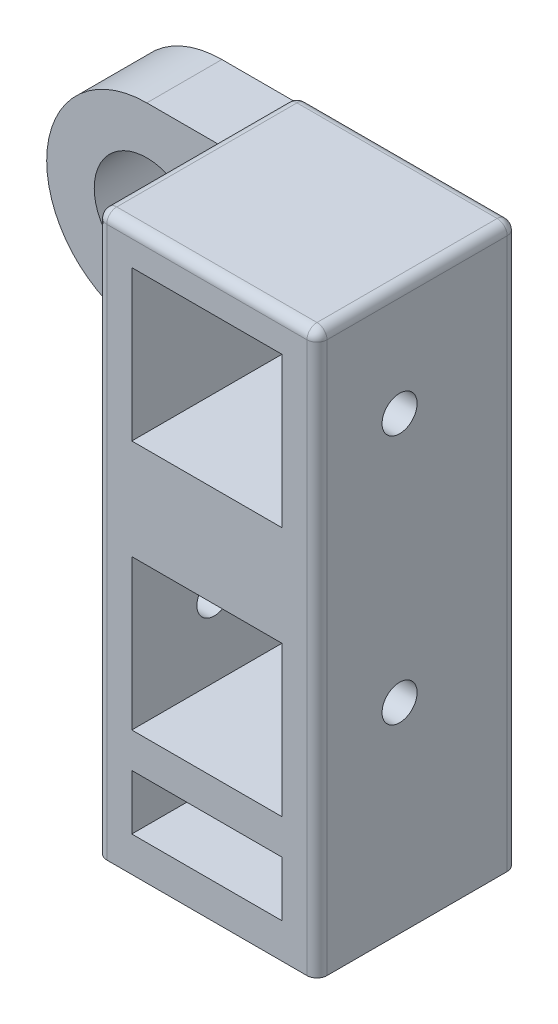
from build123d import *

# Parameters (mm, degrees)
SKETCH1_W           = 22
SKETCH1_H           = 56
SKETCH1_W_2         = 15
SKETCH1_H_2         = 15
BOSS_EXTRUDE1_DEPTH = 20
SKETCH2_W           = 15
SKETCH2_H           = 15
SKETCH2_H_2         = 5.5
CUT_EXTRUDE1_DEPTH  = 15.5
SKETCH4_R           = 5.25
BOSS_EXTRUDE3_DEPTH = 7.5
FILLET4_R           = 1
SKETCH5_R           = 1.75
CUT_EXTRUDE2_DEPTH  = 10
CUT_EXTRUDE3_START  = -10
SKETCH6_R           = 1.75
CUT_EXTRUDE3_DEPTH  = 10


with BuildPart() as part:
    # Sketch1 → Boss-Extrude1 (new body)
    with BuildSketch(Plane.XY):
        with Locations((-14.096172604, 14.333947726)):
            Rectangle(SKETCH1_W, SKETCH1_H)
        with Locations((-14.096172604, 31.333947726)):
            Rectangle(SKETCH1_W_2, SKETCH1_H_2, mode=Mode.SUBTRACT)
    extrude(amount=BOSS_EXTRUDE1_DEPTH)

    # Sketch2 → Cut-Extrude1 (cut)
    with BuildSketch(Plane.XY.offset(20)):
        with Locations((-14.096172604, 6.333947726)):
            Rectangle(SKETCH2_W, SKETCH2_H)
        with Locations((-14.096172604, -7.416052274)):
            Rectangle(SKETCH2_W, SKETCH2_H_2)
    extrude(amount=-CUT_EXTRUDE1_DEPTH, mode=Mode.SUBTRACT)

    # Sketch4 → Boss-Extrude3 (add)
    with BuildSketch(Plane(origin=(0, 0, 0), x_dir=(-1, 0, 0), z_dir=(0, 0, -1))):
        with BuildLine():
            Line((32.596172604, 41.333947726), (25.096172604, 41.333947726))
            Line((25.096172604, 41.333947726), (25.096172604, 21.333947726))
            Line((25.096172604, 21.333947726), (32.596172604, 21.333947726))
            ThreePointArc((32.596172604, 21.333947726), (42.596172604, 31.333947726), (32.596172604, 41.333947726))
        make_face()
        with Locations((32.596172604, 31.333947726)):
            Circle(SKETCH4_R, mode=Mode.SUBTRACT)
    extrude(amount=-BOSS_EXTRUDE3_DEPTH)

    # Fillet4
    fillet4_edges = [part.edges().sort_by_distance(p)[0] for p in [
        (-3.096172604, 14.333947726, 20),
        (-14.096172604, 42.333947726, 20),
        (-25.096172604, 14.333947726, 20),
        (-14.096172604, 42.333947726, 0),
        (-3.096172604, 14.333947726, 0),
        (-25.096172604, 3.833947726, 0),
        (-25.096172604, 41.833947726, 0),
        (-25.096172604, 42.333947726, 10),
        (-3.096172604, 42.333947726, 10),
    ]]
    fillet(fillet4_edges, radius=FILLET4_R - 0.0001)  # a hair under: the kernel refuses the full size

    # Sketch5 → Cut-Extrude2 (cut)
    with BuildSketch(Plane(origin=(-3.096172604, 0, 0), x_dir=(0, 0, -1), z_dir=(1, 0, 0))):
        with Locations(Location((-11.75, 31.333947726, 0), (0, 0, 90))):
            Circle(SKETCH5_R)
        with Locations(Location((-11.75, 6.333947726, 0), (0, 0, 90))):
            Circle(SKETCH5_R)
    extrude(amount=-CUT_EXTRUDE2_DEPTH, mode=Mode.SUBTRACT)

    # Sketch6 → Cut-Extrude3 (cut)
    with BuildSketch(Plane.ZY.offset(25.096172604).offset(CUT_EXTRUDE3_START)):
        with Locations(Location((11.75, 6.333947726, 0), (0, 0, 90))):
            Circle(SKETCH6_R)
    extrude(amount=CUT_EXTRUDE3_DEPTH, mode=Mode.SUBTRACT)


solid = part.part
